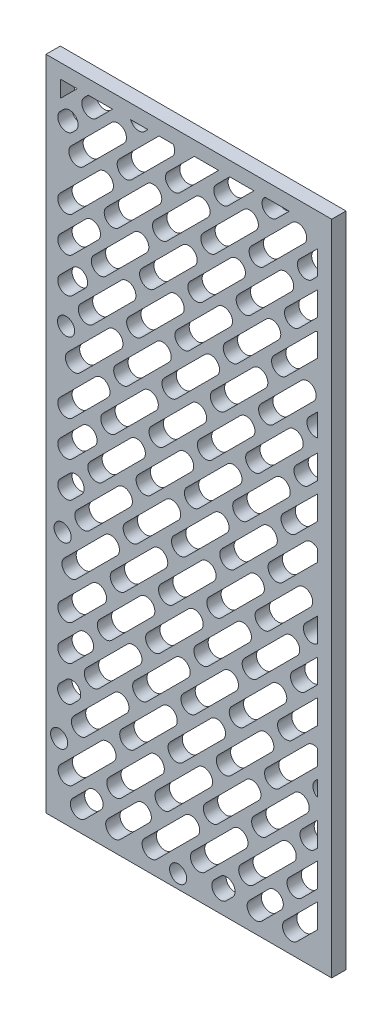
from build123d import *

# Parameters (mm, degrees)
SKETCH3_W           = 200
SKETCH3_H           = 460
BOSS_EXTRUDE1_DEPTH = 10
SKETCH4_R           = 6
CUT_EXTRUDE1_DEPTH  = 10


with BuildPart() as part:
    # Sketch3 → Boss-Extrude1 (new body)
    with BuildSketch(Plane.XY):
        with Locations((315.296784068, 355.107266296)):
            Rectangle(SKETCH3_W, SKETCH3_H)
    extrude(amount=BOSS_EXTRUDE1_DEPTH)

    # Sketch4 → Cut-Extrude1 (cut)
    with BuildSketch(Plane.XY):
        with Locations((307.802169187, 134.561007796)):
            Circle(SKETCH4_R)
        with Locations((224.497290584, 174.999815901)):
            Circle(SKETCH4_R)
        with Locations((226.924552979, 301.170765003)):
            Circle(SKETCH4_R)
        with Locations((229.351815374, 427.341714105)):
            Circle(SKETCH4_R)
        with BuildLine():
            Line((393.062985268, 550.040547434), (405.381280249, 562.214556883))
            Line((405.381280249, 562.214556883), (405.296784068, 545.357487482))
            Line((405.296784068, 545.357487482), (401.523199962, 541.530346615))
            ThreePointArc((401.523199962, 541.530346615), (393.02544027, 541.542861468), (393.062985268, 550.040547434))
        make_face()
        with BuildLine():
            Line((234.102197552, 143.592564825), (245.003371049, 154.493738322))
            ThreePointArc((245.003371049, 154.493738322), (253.488663445, 154.493739321), (253.488666442, 146.008446924))
            Line((253.488666442, 146.008446924), (242.587496081, 135.107266296))
            ThreePointArc((242.587496081, 135.107266296), (234.102197552, 135.107266296), (234.102197552, 143.592564825))
        make_face()
        with BuildLine():
            Line((258.850937748, 143.592569091), (278.810774636, 163.552405978))
            ThreePointArc((278.810774636, 163.552405978), (287.296067032, 163.552406977), (287.296070029, 155.067114581))
            Line((287.296070029, 155.067114581), (267.336240543, 135.107266296))
            ThreePointArc((267.336240543, 135.107266296), (258.850937748, 135.107266296), (258.850937748, 143.592569091))
        make_face()
        with BuildLine():
            Line((337.366916321, 147.86233708), (333.097151012, 143.59256775))
            ThreePointArc((333.097151012, 143.59256775), (333.097142954, 135.107274354), (341.582436349, 135.107266296))
            Line((341.582436349, 135.107266296), (345.852211714, 139.377045683))
            ThreePointArc((345.852211714, 139.377045683), (345.852208717, 147.862338079), (337.366916321, 147.86233708))
        make_face()
        with BuildLine():
            Line((357.845881139, 143.592565968), (371.174319908, 156.921004737))
            ThreePointArc((371.174319908, 156.921004737), (379.659612304, 156.921005736), (379.659615301, 148.435713339))
            Line((379.659615301, 148.435713339), (366.331180811, 135.107266296))
            ThreePointArc((366.331180811, 135.107266296), (357.845881139, 135.107266296), (357.845881139, 143.592565968))
        make_face()
        with BuildLine():
            Line((382.594639711, 143.59254767), (405.296784068, 166.294692027))
            Line((405.296784068, 166.294692027), (405.296784068, 149.324129279))
            Line((405.296784068, 149.324129279), (391.079921085, 135.107266296))
            ThreePointArc((391.079921085, 135.107266296), (382.594639711, 135.107266296), (382.594639711, 143.59254767))
        make_face()
        with BuildLine():
            Line((383.405868984, 473.915538191), (405.296784068, 495.806454686))
            Line((405.296784068, 495.806454686), (405.296783545, 512.043740193))
            ThreePointArc((405.296783545, 512.043740193), (404.194272273, 511.483930811), (403.229925537, 510.710010258))
            Line((403.229925537, 510.710010258), (374.94565429, 482.425739011))
            ThreePointArc((374.94565429, 482.425739011), (374.908109291, 473.928053044), (383.405868984, 473.915538191))
        make_face()
        with BuildLine():
            Line((292.819214089, 135.841496072), (321.103473616, 164.125782238))
            ThreePointArc((321.103473616, 164.125782238), (321.103470619, 172.611074634), (312.618178223, 172.611073635))
            Line((312.618178223, 172.611073635), (284.358999395, 144.351696891))
            ThreePointArc((284.358999395, 144.351696891), (284.321454397, 135.854010925), (292.819214089, 135.841496072))
        make_face()
        with BuildLine():
            Line((326.626617677, 144.900163729), (354.910877203, 173.184449895))
            ThreePointArc((354.910877203, 173.184449895), (354.910874207, 181.669742291), (346.42558181, 181.669741292))
            Line((346.42558181, 181.669741292), (318.166402983, 153.410364548))
            ThreePointArc((318.166402983, 153.410364548), (318.128857984, 144.912678582), (326.626617677, 144.900163729))
        make_face()
        with BuildLine():
            Line((360.434021264, 153.958831386), (388.718280791, 182.243117551))
            ThreePointArc((388.718280791, 182.243117551), (388.718277794, 190.728409948), (380.232985397, 190.728408949))
            Line((380.232985397, 190.728408949), (351.97380657, 162.469032205))
            ThreePointArc((351.97380657, 162.469032205), (351.936261572, 153.971346239), (360.434021264, 153.958831386))
        make_face()
        with BuildLine():
            Line((392.464534473, 507.722942403), (405.29678049, 520.555189247))
            Line((405.29678049, 520.555189247), (405.434488627, 537.412298167))
            Line((405.434488627, 537.412298167), (384.004319779, 516.233143223))
            ThreePointArc((384.004319779, 516.233143223), (383.966774781, 507.735457256), (392.464534473, 507.722942403))
        make_face()
        with BuildLine():
            Line((236.021703456, 549.270031053), (233.782082514, 547.030408001))
            ThreePointArc((233.782082514, 547.030408001), (225.296786066, 547.030402007), (225.296784068, 555.515698455))
            Line((225.296784068, 555.515698455), (227.536408063, 557.75532245))
            ThreePointArc((227.536408063, 557.75532245), (236.021700459, 557.755323449), (236.021703456, 549.270031053))
        make_face()
        with BuildLine():
            Line((225.296784068, 159.535688603), (254.062036538, 188.301142534))
            ThreePointArc((254.062036538, 188.301142534), (262.547328935, 188.301143533), (262.547331931, 179.815851136))
            Line((262.547331931, 179.815851136), (234.275570929, 151.544063507))
            ThreePointArc((234.275570929, 151.544063507), (225.79036495, 151.050482624), (225.296784068, 159.535688603))
        make_face()
        with BuildLine():
            Line((268.070475992, 160.590232627), (296.354735519, 188.874518793))
            ThreePointArc((296.354735519, 188.874518793), (296.354732522, 197.359811189), (287.869440126, 197.35981019))
            Line((287.869440126, 197.35981019), (259.610261298, 169.100433447))
            ThreePointArc((259.610261298, 169.100433447), (259.5727163, 160.60274748), (268.070475992, 160.590232627))
        make_face()
        with BuildLine():
            Line((301.877879579, 169.648900284), (330.162139106, 197.93318645))
            ThreePointArc((330.162139106, 197.93318645), (330.162136109, 206.418478846), (321.676843713, 206.418477847))
            Line((321.676843713, 206.418477847), (293.417664885, 178.159101103))
            ThreePointArc((293.417664885, 178.159101103), (293.380119887, 169.661415137), (301.877879579, 169.648900284))
        make_face()
        with BuildLine():
            Line((335.685283166, 178.707567941), (363.969542693, 206.991854107))
            ThreePointArc((363.969542693, 206.991854107), (363.969539696, 215.477146503), (355.4842473, 215.477145504))
            Line((355.4842473, 215.477145504), (327.225068472, 187.21776876))
            ThreePointArc((327.225068472, 187.21776876), (327.187523474, 178.720082794), (335.685283166, 178.707567941))
        make_face()
        with BuildLine():
            Line((369.492686753, 187.766235597), (397.77694628, 216.050521763))
            ThreePointArc((397.77694628, 216.050521763), (397.776943283, 224.535814159), (389.291650887, 224.535813161))
            Line((389.291650887, 224.535813161), (361.032472059, 196.276436417))
            ThreePointArc((361.032472059, 196.276436417), (360.994927061, 187.778750451), (369.492686753, 187.766235597))
        make_face()
        with BuildLine():
            Line((405.461319226, 413.666692934), (381.577061408, 390.062194032))
            ThreePointArc((381.577061408, 390.062194032), (381.53951641, 381.564508065), (390.037276103, 381.551993212))
            Line((390.037276103, 381.551993212), (405.296784068, 396.811502161))
            Line((405.296784068, 396.811502161), (405.461319226, 413.666692934))
        make_face()
        with BuildLine():
            Line((225.296784068, 481.269438857), (243.226480671, 499.199181683))
            ThreePointArc((243.226480671, 499.199181683), (251.711773067, 499.199182682), (251.711776064, 490.713890285))
            Line((251.711776064, 490.713890285), (233.782060787, 472.784158121))
            ThreePointArc((233.782060787, 472.784158121), (225.296782059, 472.78416013), (225.296784068, 481.269438857))
        make_face()
        with BuildLine():
            Line((243.321737894, 185.338969183), (271.605997421, 213.623255348))
            ThreePointArc((271.605997421, 213.623255348), (271.605994424, 222.108547745), (263.120702028, 222.108546746))
            Line((263.120702028, 222.108546746), (234.8615232, 193.849170002))
            ThreePointArc((234.8615232, 193.849170002), (234.823978202, 185.351484036), (243.321737894, 185.338969183))
        make_face()
        with BuildLine():
            Line((277.129141481, 194.397636839), (305.413401008, 222.681923005))
            ThreePointArc((305.413401008, 222.681923005), (305.413398011, 231.167215401), (296.928105615, 231.167214402))
            Line((296.928105615, 231.167214402), (268.668926787, 202.907837659))
            ThreePointArc((268.668926787, 202.907837659), (268.631381789, 194.410151692), (277.129141481, 194.397636839))
        make_face()
        with BuildLine():
            Line((310.936545068, 203.456304496), (339.220804595, 231.740590662))
            ThreePointArc((339.220804595, 231.740590662), (339.220801598, 240.225883058), (330.735509202, 240.225882059))
            Line((330.735509202, 240.225882059), (302.476330374, 211.966505315))
            ThreePointArc((302.476330374, 211.966505315), (302.438785376, 203.468819349), (310.936545068, 203.456304496))
        make_face()
        with BuildLine():
            Line((344.743948655, 212.514972153), (373.028208182, 240.799258318))
            ThreePointArc((373.028208182, 240.799258318), (373.028205185, 249.284550715), (364.542912789, 249.284549716))
            Line((364.542912789, 249.284549716), (336.283733961, 221.025172972))
            ThreePointArc((336.283733961, 221.025172972), (336.246188963, 212.527487006), (344.743948655, 212.514972153))
        make_face()
        with BuildLine():
            Line((378.551352243, 221.573639809), (405.296784068, 248.319096823))
            Line((405.296784068, 248.319096823), (405.296784068, 259.456825912))
            ThreePointArc((405.296784068, 259.456825912), (401.643202502, 260.024932818), (398.350302522, 258.343203516))
            Line((398.350302522, 258.343203516), (370.091137549, 230.083840629))
            ThreePointArc((370.091137549, 230.083840629), (370.05359255, 221.586154662), (378.551352243, 221.573639809))
        make_face()
        with BuildLine():
            Line((234.167815182, 465.391777471), (225.296784068, 456.520746357))
            ThreePointArc((225.296784068, 456.520746357), (225.296760069, 448.035448784), (233.782057642, 448.035424785))
            Line((233.782057642, 448.035424785), (242.653110575, 456.906486073))
            ThreePointArc((242.653110575, 456.906486073), (242.653107578, 465.39177847), (234.167815182, 465.391777471))
        make_face()
        with BuildLine():
            Line((252.380403383, 219.146373394), (280.66466291, 247.43065956))
            ThreePointArc((280.66466291, 247.43065956), (280.664659913, 255.915951956), (272.179367517, 255.915950957))
            Line((272.179367517, 255.915950957), (243.920188689, 227.656574214))
            ThreePointArc((243.920188689, 227.656574214), (243.882643691, 219.158888248), (252.380403383, 219.146373394))
        make_face()
        with BuildLine():
            Line((286.187806971, 228.205041051), (314.472066497, 256.489327217))
            ThreePointArc((314.472066497, 256.489327217), (314.472063501, 264.974619613), (305.986771104, 264.974618614))
            Line((305.986771104, 264.974618614), (277.727592277, 236.715241871))
            ThreePointArc((277.727592277, 236.715241871), (277.690047278, 228.217555904), (286.187806971, 228.205041051))
        make_face()
        with BuildLine():
            Line((319.995210558, 237.263708708), (348.279470085, 265.547994874))
            ThreePointArc((348.279470085, 265.547994874), (348.279467088, 274.03328727), (339.794174691, 274.033286271))
            Line((339.794174691, 274.033286271), (311.534995864, 245.773909527))
            ThreePointArc((311.534995864, 245.773909527), (311.497450866, 237.276223561), (319.995210558, 237.263708708))
        make_face()
        with BuildLine():
            Line((353.802614145, 246.322376365), (382.086873672, 274.60666253))
            ThreePointArc((382.086873672, 274.60666253), (382.086870675, 283.091954927), (373.601578279, 283.091953928))
            Line((373.601578279, 283.091953928), (345.342399451, 254.832577184))
            ThreePointArc((345.342399451, 254.832577184), (345.304854453, 246.334891218), (353.802614145, 246.322376365))
        make_face()
        with BuildLine():
            Line((405.296784068, 421.5602403), (399.095941592, 415.359397424))
            ThreePointArc((399.095941592, 415.359397424), (390.5981819, 415.371912277), (390.635726898, 423.869598244))
            Line((390.635726898, 423.869598244), (405.296784068, 438.358928853))
            Line((405.296784068, 438.358928853), (405.296784068, 421.5602403))
        make_face()
        with BuildLine():
            Line((249.85788779, 406.835636704), (225.296759831, 382.274508744))
            ThreePointArc((225.296759831, 382.274508744), (225.29676083, 373.789203783), (233.782065791, 373.789204782))
            Line((233.782065791, 373.789204782), (258.343183183, 398.350345306))
            ThreePointArc((258.343183183, 398.350345306), (258.343180186, 406.835637703), (249.85788779, 406.835636704))
        make_face()
        with BuildLine():
            Line((261.439068873, 252.953777606), (289.7233284, 281.238063772))
            ThreePointArc((289.7233284, 281.238063772), (289.723325403, 289.723356168), (281.238033007, 289.723355169))
            Line((281.238033007, 289.723355169), (252.978854179, 261.463978426))
            ThreePointArc((252.978854179, 261.463978426), (252.941309181, 252.966292459), (261.439068873, 252.953777606))
        make_face()
        with BuildLine():
            Line((295.24647246, 262.012445263), (323.530731987, 290.296731429))
            ThreePointArc((323.530731987, 290.296731429), (323.53072899, 298.782023825), (315.045436594, 298.782022826))
            Line((315.045436594, 298.782022826), (286.786257766, 270.522646082))
            ThreePointArc((286.786257766, 270.522646082), (286.748712768, 262.024960116), (295.24647246, 262.012445263))
        make_face()
        with BuildLine():
            Line((329.053876047, 271.07111292), (357.338135574, 299.355399086))
            ThreePointArc((357.338135574, 299.355399086), (357.338132577, 307.840691482), (348.852840181, 307.840690483))
            Line((348.852840181, 307.840690483), (320.593661353, 279.581313739))
            ThreePointArc((320.593661353, 279.581313739), (320.556116355, 271.083627773), (329.053876047, 271.07111292))
        make_face()
        with BuildLine():
            Line((362.861279634, 280.129780577), (391.145539161, 308.414066742))
            ThreePointArc((391.145539161, 308.414066742), (391.145536164, 316.899359139), (382.660243768, 316.89935814))
            Line((382.660243768, 316.89935814), (354.40106494, 288.639981396))
            ThreePointArc((354.40106494, 288.639981396), (354.363519942, 280.14229543), (362.861279634, 280.129780577))
        make_face()
        with BuildLine():
            Line((387.610017732, 255.381044021), (405.296784068, 273.067811497))
            Line((405.296784068, 273.067811497), (405.296784068, 290.038225871))
            Line((405.296784068, 290.038225871), (379.149803038, 263.891244841))
            ThreePointArc((379.149803038, 263.891244841), (379.11225804, 255.393558874), (387.610017732, 255.381044021))
        make_face()
        with BuildLine():
            Line((249.284517694, 364.542941094), (233.782062731, 349.040471531))
            ThreePointArc((233.782062731, 349.040471531), (225.296762035, 349.040493564), (225.296784068, 357.525794259))
            Line((225.296784068, 357.525794259), (240.799222301, 373.028232492))
            ThreePointArc((240.799222301, 373.028232492), (249.284514697, 373.028233491), (249.284517694, 364.542941094))
        make_face()
        with BuildLine():
            Line((236.690330775, 277.702514162), (264.974590302, 305.986800327))
            ThreePointArc((264.974590302, 305.986800327), (264.974587305, 314.472092724), (256.489294909, 314.472091725))
            Line((256.489294909, 314.472091725), (228.230116081, 286.212714981))
            ThreePointArc((228.230116081, 286.212714981), (228.192571083, 277.715029015), (236.690330775, 277.702514162))
        make_face()
        with BuildLine():
            Line((270.497734362, 286.761181818), (298.781993889, 315.045467984))
            ThreePointArc((298.781993889, 315.045467984), (298.781990892, 323.53076038), (290.296698496, 323.530759381))
            Line((290.296698496, 323.530759381), (262.037519668, 295.271382638))
            ThreePointArc((262.037519668, 295.271382638), (261.99997467, 286.773696671), (270.497734362, 286.761181818))
        make_face()
        with BuildLine():
            Line((304.305137949, 295.819849475), (332.589397476, 324.104135641))
            ThreePointArc((332.589397476, 324.104135641), (332.589394479, 332.589428037), (324.104102083, 332.589427038))
            Line((324.104102083, 332.589427038), (295.844923255, 304.330050294))
            ThreePointArc((295.844923255, 304.330050294), (295.807378257, 295.832364328), (304.305137949, 295.819849475))
        make_face()
        with BuildLine():
            Line((338.112541537, 304.878517132), (366.396801063, 333.162803298))
            ThreePointArc((366.396801063, 333.162803298), (366.396798067, 341.648095694), (357.91150567, 341.648094695))
            Line((357.91150567, 341.648094695), (329.652326843, 313.388717951))
            ThreePointArc((329.652326843, 313.388717951), (329.614781844, 304.891031985), (338.112541537, 304.878517132))
        make_face()
        with BuildLine():
            Line((371.919945124, 313.937184788), (400.204204651, 342.221470954))
            ThreePointArc((400.204204651, 342.221470954), (400.204201654, 350.70676335), (391.718909257, 350.706762351))
            Line((391.718909257, 350.706762351), (363.45973043, 322.447385608))
            ThreePointArc((363.45973043, 322.447385608), (363.422185431, 313.949699642), (371.919945124, 313.937184788))
        make_face()
        with BuildLine():
            Line((388.208468527, 297.698649053), (405.296784065, 314.586807288))
            Line((405.296784065, 314.586807288), (405.296784068, 297.816549636))
            Line((405.296784068, 297.816549636), (396.668683221, 289.188448233))
            ThreePointArc((396.668683221, 289.188448233), (388.170923529, 289.200963086), (388.208468527, 297.698649053))
        make_face()
        with BuildLine():
            Line((225.296784068, 332.777055537), (231.740556811, 339.22082828))
            ThreePointArc((231.740556811, 339.22082828), (240.225849207, 339.220829279), (240.225852204, 330.735536883))
            Line((240.225852204, 330.735536883), (233.782057519, 324.291742197))
            ThreePointArc((233.782057519, 324.291742197), (225.296764124, 324.291762142), (225.296784068, 332.777055537))
        make_face()
        with BuildLine():
            Line((245.748996265, 311.509918373), (274.033255791, 339.794204539))
            ThreePointArc((274.033255791, 339.794204539), (274.033252795, 348.279496935), (265.547960398, 348.279495936))
            Line((265.547960398, 348.279495936), (237.288781571, 320.020119193))
            ThreePointArc((237.288781571, 320.020119193), (237.251236572, 311.522433227), (245.748996265, 311.509918373))
        make_face()
        with BuildLine():
            Line((279.556399852, 320.56858603), (307.840659379, 348.852872196))
            ThreePointArc((307.840659379, 348.852872196), (307.840656382, 357.338164592), (299.355363985, 357.338163593))
            Line((299.355363985, 357.338163593), (271.096185158, 329.07878685))
            ThreePointArc((271.096185158, 329.07878685), (271.05864016, 320.581100883), (279.556399852, 320.56858603))
        make_face()
        with BuildLine():
            Line((313.363803439, 329.627253687), (341.648062966, 357.911539853))
            ThreePointArc((341.648062966, 357.911539853), (341.648059969, 366.396832249), (333.162767573, 366.39683125))
            Line((333.162767573, 366.39683125), (304.903588745, 338.137454506))
            ThreePointArc((304.903588745, 338.137454506), (304.866043747, 329.63976854), (313.363803439, 329.627253687))
        make_face()
        with BuildLine():
            Line((347.171207026, 338.685921344), (375.455466553, 366.970207509))
            ThreePointArc((375.455466553, 366.970207509), (375.455463556, 375.455499906), (366.97017116, 375.455498907))
            Line((366.97017116, 375.455498907), (338.710992332, 347.196122163))
            ThreePointArc((338.710992332, 347.196122163), (338.673447334, 338.698436197), (347.171207026, 338.685921344))
        make_face()
        with BuildLine():
            Line((380.978610613, 347.744589), (405.296784068, 372.062785359))
            Line((405.296784068, 372.062785359), (405.296784068, 380.548076636))
            ThreePointArc((405.296784068, 380.548076636), (401.054134326, 382.305430998), (396.811492788, 380.548056828))
            Line((396.811492788, 380.548056828), (372.518395919, 356.25478982))
            ThreePointArc((372.518395919, 356.25478982), (372.480850921, 347.757103853), (380.978610613, 347.744589))
        make_face()
        with BuildLine():
            Line((225.296784068, 258.530842161), (247.43062942, 280.664687513))
            ThreePointArc((247.43062942, 280.664687513), (255.915921816, 280.664688512), (255.915924813, 272.179396115))
            Line((255.915924813, 272.179396115), (233.782077463, 250.045548766))
            ThreePointArc((233.782077463, 250.045548766), (225.296784068, 250.045548766), (225.296784068, 258.530842161))
        make_face()
        with BuildLine():
            Line((254.807661754, 345.317322585), (283.091921281, 373.601608751))
            ThreePointArc((283.091921281, 373.601608751), (283.091918284, 382.086901147), (274.606625888, 382.086900148))
            Line((274.606625888, 382.086900148), (246.34744706, 353.827523405))
            ThreePointArc((246.34744706, 353.827523405), (246.309902062, 345.329837438), (254.807661754, 345.317322585))
        make_face()
        with BuildLine():
            Line((288.615065341, 354.375990242), (316.899324868, 382.660276408))
            ThreePointArc((316.899324868, 382.660276408), (316.899321871, 391.145568804), (308.414029475, 391.145567805))
            Line((308.414029475, 391.145567805), (280.154850647, 362.886191061))
            ThreePointArc((280.154850647, 362.886191061), (280.117305649, 354.388505095), (288.615065341, 354.375990242))
        make_face()
        with BuildLine():
            Line((322.422468928, 363.434657899), (350.706728455, 391.718944065))
            ThreePointArc((350.706728455, 391.718944065), (350.706725458, 400.204236461), (342.221433062, 400.204235462))
            Line((342.221433062, 400.204235462), (313.962254234, 371.944858718))
            ThreePointArc((313.962254234, 371.944858718), (313.924709236, 363.447172752), (322.422468928, 363.434657899))
        make_face()
        with BuildLine():
            Line((356.229872515, 372.493325556), (384.514132042, 400.777611721))
            ThreePointArc((384.514132042, 400.777611721), (384.514129045, 409.262904118), (376.028836649, 409.262903119))
            Line((376.028836649, 409.262903119), (347.769657821, 381.003526375))
            ThreePointArc((347.769657821, 381.003526375), (347.732112823, 372.505840409), (356.229872515, 372.493325556))
        make_face()
        with BuildLine():
            Line((394.241424851, 163.017499042), (405.296784068, 174.072858972))
            Line((405.296784068, 174.072858972), (405.296784068, 191.043273773))
            Line((405.296784068, 191.043273773), (385.781210157, 171.527699862))
            ThreePointArc((385.781210157, 171.527699862), (385.743665159, 163.030013895), (394.241424851, 163.017499042))
        make_face()
        with BuildLine():
            Line((233.782073872, 225.29679249), (246.857259323, 238.371991903))
            ThreePointArc((246.857259323, 238.371991903), (246.857256326, 246.8572843), (238.37196393, 246.857283301))
            Line((238.37196393, 246.857283301), (225.296784068, 233.78206543))
            ThreePointArc((225.296784068, 233.78206543), (225.296794451, 225.296786009), (233.782073872, 225.29679249))
        make_face()
        with BuildLine():
            Line((263.866327243, 379.124726797), (292.15058677, 407.409012963))
            ThreePointArc((292.15058677, 407.409012963), (292.150583773, 415.894305359), (283.665291377, 415.89430436))
            Line((283.665291377, 415.89430436), (255.406112549, 387.634927617))
            ThreePointArc((255.406112549, 387.634927617), (255.368567551, 379.13724165), (263.866327243, 379.124726797))
        make_face()
        with BuildLine():
            Line((297.673730831, 388.183394454), (325.957990357, 416.46768062))
            ThreePointArc((325.957990357, 416.46768062), (325.957987361, 424.952973016), (317.472694964, 424.952972017))
            Line((317.472694964, 424.952972017), (289.213516137, 396.693595273))
            ThreePointArc((289.213516137, 396.693595273), (289.175971138, 388.195909307), (297.673730831, 388.183394454))
        make_face()
        with BuildLine():
            Line((331.481134418, 397.242062111), (359.765393945, 425.526348277))
            ThreePointArc((359.765393945, 425.526348277), (359.765390948, 434.011640673), (351.280098551, 434.011639674))
            Line((351.280098551, 434.011639674), (323.020919724, 405.75226293))
            ThreePointArc((323.020919724, 405.75226293), (322.983374725, 397.254576964), (331.481134418, 397.242062111))
        make_face()
        with BuildLine():
            Line((365.288538005, 406.300729767), (393.572797532, 434.585015933))
            ThreePointArc((393.572797532, 434.585015933), (393.572794535, 443.070308329), (385.087502139, 443.07030733))
            Line((385.087502139, 443.07030733), (356.828323311, 414.810930587))
            ThreePointArc((356.828323311, 414.810930587), (356.790778313, 406.313244621), (365.288538005, 406.300729767))
        make_face()
        with BuildLine():
            Line((403.30009034, 196.824903254), (405.296784068, 198.821597111))
            Line((405.296784068, 198.821597111), (405.296784068, 215.792012496))
            Line((405.296784068, 215.792012496), (394.839875646, 205.335104074))
            ThreePointArc((394.839875646, 205.335104074), (394.802330648, 196.837418107), (403.30009034, 196.824903254))
        make_face()
        with BuildLine():
            Line((225.296784068, 209.033328101), (229.313298441, 213.049879089))
            ThreePointArc((229.313298441, 213.049879089), (237.798590837, 213.049880088), (237.798593834, 204.564587692))
            Line((237.798593834, 204.564587692), (233.555945138, 200.321925715))
            ThreePointArc((233.555945138, 200.321925715), (225.070663411, 200.548046373), (225.296784068, 209.033328101))
        make_face()
        with BuildLine():
            Line((239.117589146, 403.873463352), (267.401848673, 432.157749518))
            ThreePointArc((267.401848673, 432.157749518), (267.401845676, 440.643041914), (258.916553279, 440.643040916))
            Line((258.916553279, 440.643040916), (230.657374452, 412.383664172))
            ThreePointArc((230.657374452, 412.383664172), (230.619829454, 403.885978206), (239.117589146, 403.873463352))
        make_face()
        with BuildLine():
            Line((272.924992733, 412.932131009), (301.20925226, 441.216417175))
            ThreePointArc((301.20925226, 441.216417175), (301.209249263, 449.701709571), (292.723956867, 449.701708572))
            Line((292.723956867, 449.701708572), (264.464778039, 421.442331829))
            ThreePointArc((264.464778039, 421.442331829), (264.427233041, 412.944645862), (272.924992733, 412.932131009))
        make_face()
        with BuildLine():
            Line((306.73239632, 421.990798666), (335.016655847, 450.275084832))
            ThreePointArc((335.016655847, 450.275084832), (335.01665285, 458.760377228), (326.531360454, 458.760376229))
            Line((326.531360454, 458.760376229), (298.272181626, 430.500999485))
            ThreePointArc((298.272181626, 430.500999485), (298.234636628, 422.003313519), (306.73239632, 421.990798666))
        make_face()
        with BuildLine():
            Line((340.539799907, 431.049466323), (368.824059434, 459.333752488))
            ThreePointArc((368.824059434, 459.333752488), (368.824056437, 467.819044885), (360.338764041, 467.819043886))
            Line((360.338764041, 467.819043886), (332.079585213, 439.559667142))
            ThreePointArc((332.079585213, 439.559667142), (332.042040215, 431.061981176), (340.539799907, 431.049466323))
        make_face()
        with BuildLine():
            Line((374.347203494, 440.108133979), (402.631463021, 468.392420145))
            ThreePointArc((402.631463021, 468.392420145), (402.631460024, 476.877712541), (394.146167628, 476.877711542))
            Line((394.146167628, 476.877711542), (365.8869888, 448.618334799))
            ThreePointArc((365.8869888, 448.618334799), (365.849443802, 440.120648832), (374.347203494, 440.108133979))
        make_face()
        Polygon((225.296784068, 563.293831754), (225.296784068, 575.107266296), (237.110207484, 575.107266296), align=None)
        with BuildLine():
            Line((248.176254635, 437.680867564), (276.460514162, 465.96515373))
            ThreePointArc((276.460514162, 465.96515373), (276.460511165, 474.450446126), (267.975218769, 474.450445127))
            Line((267.975218769, 474.450445127), (239.716039941, 446.191068384))
            ThreePointArc((239.716039941, 446.191068384), (239.678494943, 437.693382417), (248.176254635, 437.680867564))
        make_face()
        with BuildLine():
            Line((281.983658222, 446.739535221), (310.267917749, 475.023821387))
            ThreePointArc((310.267917749, 475.023821387), (310.267914752, 483.509113783), (301.782622356, 483.509112784))
            Line((301.782622356, 483.509112784), (273.523443528, 455.24973604))
            ThreePointArc((273.523443528, 455.24973604), (273.48589853, 446.752050074), (281.983658222, 446.739535221))
        make_face()
        with BuildLine():
            Line((315.791061809, 455.798202878), (344.075321336, 484.082489044))
            ThreePointArc((344.075321336, 484.082489044), (344.075318339, 492.56778144), (335.590025943, 492.567780441))
            Line((335.590025943, 492.567780441), (307.330847115, 464.308403697))
            ThreePointArc((307.330847115, 464.308403697), (307.293302117, 455.810717731), (315.791061809, 455.798202878))
        make_face()
        with BuildLine():
            Line((349.598465397, 464.856870535), (377.882724923, 493.1411567))
            ThreePointArc((377.882724923, 493.1411567), (377.882721926, 501.626449097), (369.39742953, 501.626448098))
            Line((369.39742953, 501.626448098), (341.138250702, 473.367071354))
            ThreePointArc((341.138250702, 473.367071354), (341.100705704, 464.869385388), (349.598465397, 464.856870535))
        make_face()
        with BuildLine():
            Line((261.858951946, 575.107266296), (244.888527806, 575.107266296))
            Line((244.888527806, 575.107266296), (242.143298312, 572.362017575))
            ThreePointArc((242.143298312, 572.362017575), (242.105753313, 563.864331608), (250.603513006, 563.851816755))
            Line((250.603513006, 563.851816755), (261.858951946, 575.107266296))
        make_face()
        with BuildLine():
            Line((274.527846204, 575.107262229), (286.607697899, 575.107267787))
            Line((286.607697899, 575.107267787), (284.410918454, 572.910486273))
            ThreePointArc((284.410918454, 572.910486273), (278.866389372, 571.296070087), (274.527846204, 575.107262229))
        make_face()
        with BuildLine():
            Line((257.234920125, 471.488271776), (285.519179651, 499.772557942))
            ThreePointArc((285.519179651, 499.772557942), (285.519176655, 508.257850338), (277.033884258, 508.257849339))
            Line((277.033884258, 508.257849339), (248.774705431, 479.998472596))
            ThreePointArc((248.774705431, 479.998472596), (248.737160432, 471.500786629), (257.234920125, 471.488271776))
        make_face()
        with BuildLine():
            Line((291.042323712, 480.546939433), (319.326583239, 508.831225599))
            ThreePointArc((319.326583239, 508.831225599), (319.326580242, 517.316517995), (310.841287845, 517.316516996))
            Line((310.841287845, 517.316516996), (282.582109018, 489.057140252))
            ThreePointArc((282.582109018, 489.057140252), (282.544564019, 480.559454286), (291.042323712, 480.546939433))
        make_face()
        with BuildLine():
            Line((324.849727299, 489.60560709), (353.133986826, 517.889893256))
            ThreePointArc((353.133986826, 517.889893256), (353.133983829, 526.375185652), (344.648691433, 526.375184653))
            Line((344.648691433, 526.375184653), (316.389512605, 498.115807909))
            ThreePointArc((316.389512605, 498.115807909), (316.351967607, 489.618121943), (324.849727299, 489.60560709))
        make_face()
        with BuildLine():
            Line((358.657130886, 498.664274746), (386.941390413, 526.948560912))
            ThreePointArc((386.941390413, 526.948560912), (386.941387416, 535.433853308), (378.45609502, 535.43385231))
            Line((378.45609502, 535.43385231), (350.196916192, 507.174475566))
            ThreePointArc((350.196916192, 507.174475566), (350.159371194, 498.6767896), (358.657130886, 498.664274746))
        make_face()
        with BuildLine():
            Line((294.38582913, 575.107266296), (304.283510337, 575.107285932))
            ThreePointArc((304.283510337, 575.107285932), (305.372908857, 571.128912372), (303.63651063, 567.387366366))
            Line((303.63651063, 567.387366366), (275.352251103, 539.1030802))
            ThreePointArc((275.352251103, 539.1030802), (266.854491411, 539.115595053), (266.892036409, 547.61328102))
            Line((266.892036409, 547.61328102), (294.38582913, 575.107266296))
        make_face()
        with BuildLine():
            Line((319.134628504, 575.107266296), (336.105160932, 575.107279477))
            Line((336.105160932, 575.107279477), (309.159654691, 548.161747857))
            ThreePointArc((309.159654691, 548.161747857), (300.661894998, 548.17426271), (300.699439996, 556.671948676))
            Line((300.699439996, 556.671948676), (319.134628504, 575.107266296))
        make_face()
        with BuildLine():
            Line((233.782066403, 497.532893928), (260.770441554, 524.521294497))
            ThreePointArc((260.770441554, 524.521294497), (260.770438557, 533.006586894), (252.285146161, 533.006585895))
            Line((252.285146161, 533.006585895), (225.296784068, 506.018034787))
            ThreePointArc((225.296784068, 506.018034787), (225.279614277, 497.515582373), (233.782066403, 497.532893928))
        make_face()
        with BuildLine():
            Line((266.293585614, 505.295675988), (294.577845141, 533.579962154))
            ThreePointArc((294.577845141, 533.579962154), (294.577842144, 542.06525455), (286.092549748, 542.065253551))
            Line((286.092549748, 542.065253551), (257.83337092, 513.805876808))
            ThreePointArc((257.83337092, 513.805876808), (257.795825922, 505.308190841), (266.293585614, 505.295675988))
        make_face()
        with BuildLine():
            Line((300.100989201, 514.354343645), (328.385248728, 542.638629811))
            ThreePointArc((328.385248728, 542.638629811), (328.385245731, 551.123922207), (319.899953335, 551.123921208))
            Line((319.899953335, 551.123921208), (291.640774507, 522.864544464))
            ThreePointArc((291.640774507, 522.864544464), (291.603229509, 514.366858498), (300.100989201, 514.354343645))
        make_face()
        with BuildLine():
            Line((333.908392788, 523.413011302), (362.192652315, 551.697297467))
            ThreePointArc((362.192652315, 551.697297467), (362.192649318, 560.182589864), (353.707356922, 560.182588865))
            Line((353.707356922, 560.182588865), (325.448178094, 531.923212121))
            ThreePointArc((325.448178094, 531.923212121), (325.410633096, 523.425526155), (333.908392788, 523.413011302))
        make_face()
        with BuildLine():
            Line((367.715796375, 532.471678958), (396.000055902, 560.755965124))
            ThreePointArc((396.000055902, 560.755965124), (396.000052905, 569.24125752), (387.514760509, 569.241256521))
            Line((387.514760509, 569.241256521), (359.255581681, 540.981879778))
            ThreePointArc((359.255581681, 540.981879778), (359.218036683, 532.484193811), (367.715796375, 532.471678958))
        make_face()
        with BuildLine():
            Line((343.883427877, 575.107266296), (360.853892214, 575.107266296))
            Line((360.853892214, 575.107266296), (342.967058278, 557.220415514))
            ThreePointArc((342.967058278, 557.220415514), (334.469298585, 557.232930367), (334.506843584, 565.730616333))
            Line((334.506843584, 565.730616333), (343.883427877, 575.107266296))
        make_face()
        with BuildLine():
            Line((385.602642773, 575.107272394), (368.632156687, 575.107195732))
            Line((368.632156687, 575.107195732), (368.314247171, 574.78928399))
            ThreePointArc((368.314247171, 574.78928399), (368.276702173, 566.291598023), (376.774461865, 566.27908317))
            Line((376.774461865, 566.27908317), (385.602642773, 575.107272394))
        make_face()
        with BuildLine():
            Line((241.544847516, 530.044412543), (269.829107043, 558.328698709))
            ThreePointArc((269.829107043, 558.328698709), (269.829104046, 566.813991105), (261.34381165, 566.813990106))
            Line((261.34381165, 566.813990106), (233.084632822, 538.554613363))
            ThreePointArc((233.084632822, 538.554613363), (233.047087824, 530.056927397), (241.544847516, 530.044412543))
        make_face()
        with BuildLine():
            Line((405.296784068, 447.571438948), (405.296784068, 463.279540257))
            Line((405.296784068, 463.279540257), (399.669326779, 457.652082968))
            ThreePointArc((399.669326779, 457.652082968), (398.673013792, 450.484828739), (405.296784068, 447.571438948))
        make_face()
        with BuildLine():
            Line((397.26713402, 331.506053265), (405.296784068, 339.53575955))
            Line((405.296784068, 339.53575955), (405.296784068, 322.605127566))
            ThreePointArc((405.296784068, 322.605127566), (397.02962914, 323.219503904), (397.26713402, 331.506053265))
        make_face()
        with BuildLine():
            Line((403.898541138, 239.142508286), (405.296784068, 240.524373445))
            Line((405.296784068, 240.524373445), (405.296784068, 229.578593322))
            ThreePointArc((405.296784068, 229.578593322), (402.179228224, 234.006976061), (403.898541138, 239.142508286))
        make_face()
    extrude(amount=CUT_EXTRUDE1_DEPTH, mode=Mode.SUBTRACT)


solid = part.part
